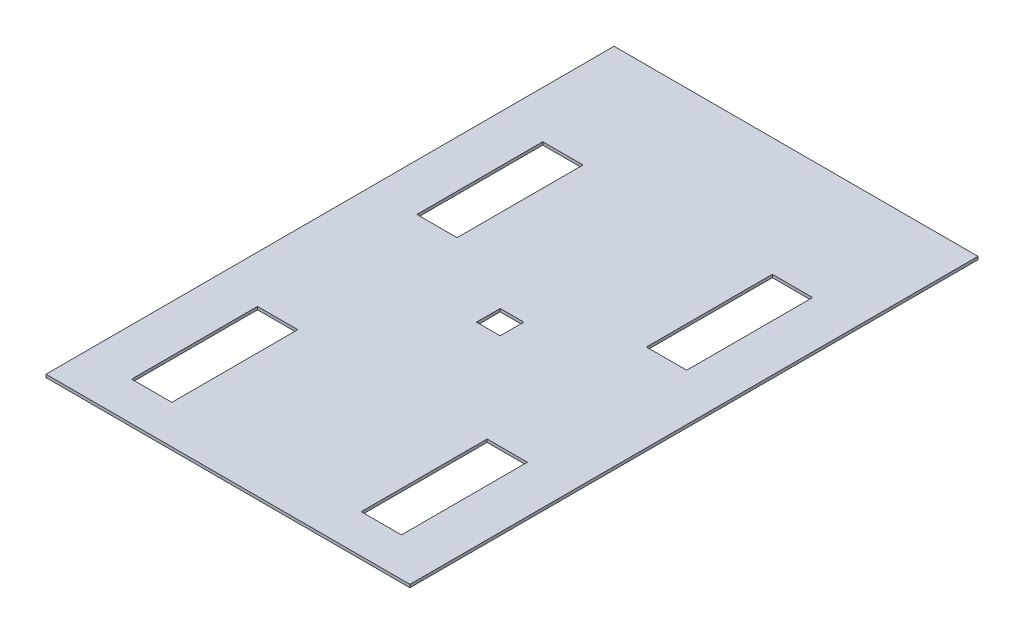
from build123d import *

# Parameters (mm, degrees)
SKETCH1_W           = 390.525
SKETCH1_H           = 609.6
BOSS_EXTRUDE1_DEPTH = 3.175
SKETCH2_W           = 43.18
SKETCH2_H           = 135.128
CUT_EXTRUDE1_DEPTH  = 362.995254846
SKETCH4_W           = 25.4
SKETCH4_H           = 25.4
CUT_EXTRUDE3_DEPTH  = 362.995254846


with BuildPart() as part:
    # Sketch1 → Boss-Extrude1 (new body)
    with BuildSketch(Plane(origin=(0, 0, 0), x_dir=(1, 0, 0), z_dir=(0, 1, 0))):
        Rectangle(SKETCH1_W, SKETCH1_H)
    extrude(amount=BOSS_EXTRUDE1_DEPTH)

    # Sketch2 → Cut-Extrude1 (cut, through all)
    with BuildSketch(Plane(origin=(0, 3.175, 0), x_dir=(1, 0, 0), z_dir=(0, 1, 0))):
        with Locations((123.19, -195.8594)):
            Rectangle(SKETCH2_W, SKETCH2_H)
        with Locations((123.19, 110.236)):
            Rectangle(SKETCH2_W, SKETCH2_H)
        with Locations((-123.19, -195.8594)):
            Rectangle(SKETCH2_W, SKETCH2_H)
        with Locations((-123.19, 110.236)):
            Rectangle(SKETCH2_W, SKETCH2_H)
    extrude(amount=-CUT_EXTRUDE1_DEPTH, mode=Mode.SUBTRACT)

    # Sketch4 → Cut-Extrude3 (cut, through all)
    with BuildSketch(Plane(origin=(0, 0, 0), x_dir=(1, 0, 0), z_dir=(0, 1, 0))):
        with Locations((0, -12.7)):
            Rectangle(SKETCH4_W, SKETCH4_H)
    extrude(amount=CUT_EXTRUDE3_DEPTH, mode=Mode.SUBTRACT)


solid = part.part
